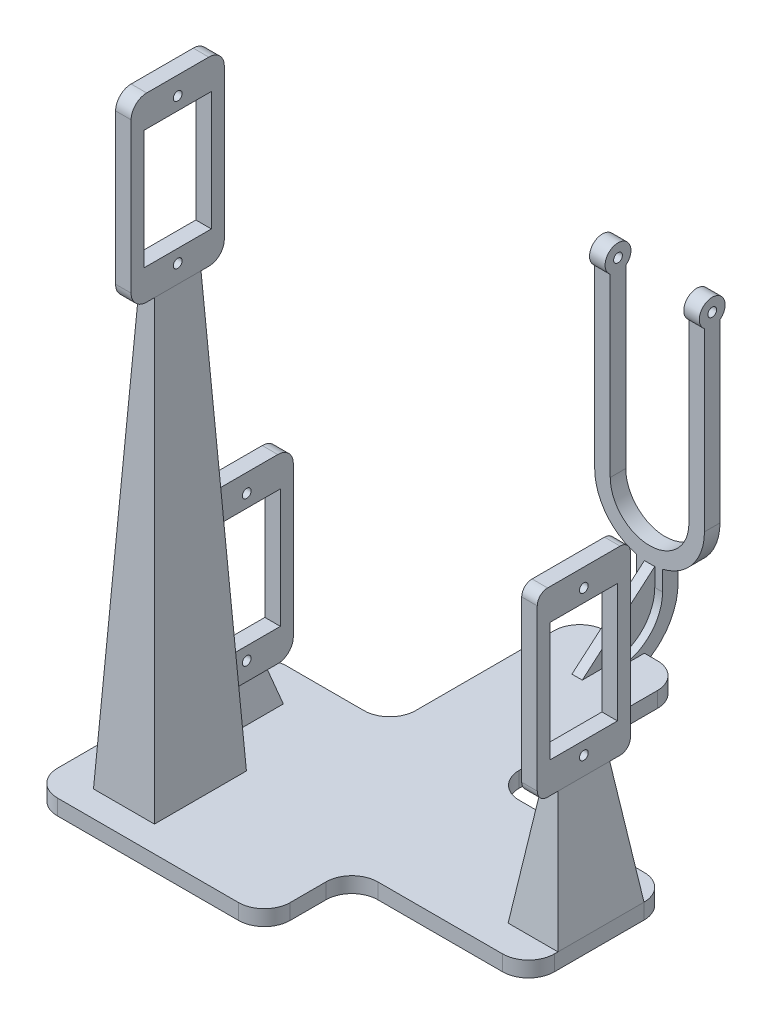
from build123d import *

# Parameters (mm, degrees)
ESBO_O1_R                     = 2.5
RESSALTO_EXTRUS_O1_DEPTH      = 10.6
ESBO_O8_W                     = 21.2
ESBO_O8_H                     = 35
RESSALTO_EXTRUS_O6_DEPTH      = 1.5
RESSALTO_EXTRUS_O2_DEPTH      = 1.5
CORTE_EXTRUS_O1_DEPTH         = 48.855720661
CORTE_EXTRUS_O1_DEPTH_BACK    = 48.855720661
ESBO_O3_W                     = 15.2
ESBO_O3_H                     = 37.5
CORTE_EXTRUS_O2_DEPTH         = 48.855720661
CORTE_EXTRUS_O2_DEPTH_BACK    = 48.855720661
ESBO_O4_R                     = 0.85
ESBO_O5_W                     = 3
ESBO_O5_H                     = 5
RESSALTO_EXTRUS_O3_DEPTH      = 2.5
RESSALTO_EXTRUS_O4_DEPTH      = 2.5
RESSALTO_EXTRUS_O5_START      = -58.6
ESBO_O7_W                     = 20
ESBO_O7_H                     = 64
RESSALTO_EXTRUS_O5_DEPTH      = 3
NERVURA2_REACH                = 95.102
ESBO_O10_WALL_W               = 206.642418638
ESBO_O10_WALL_H               = 2
ESBO_O11_W                    = 18
ESBO_O11_H                    = 35
RESSALTO_EXTRUS_O7_DEPTH      = 3
ESBO_O12_W                    = 13
ESBO_O12_H                    = 23
CORTE_EXTRUS_O3_DEPTH         = 106.818334895
ESBO_O13_R                    = 0.85
CORTE_EXTRUS_O4_DEPTH         = 106.818334895
FILETE1_R                     = 2
RESSALTO_EXTRUS_O11_OUTLINE_W = 9.625094948
RESSALTO_EXTRUS_O11_OUTLINE_H = 16.625094948
RESSALTO_EXTRUS_O11_DEPTH     = 23.57
RESSALTO_EXTRUS_O11_TAPER     = 8
RESSALTO_EXTRUS_O9_START      = -28.42
ESBO_O19_W                    = 18
ESBO_O19_H                    = 35
RESSALTO_EXTRUS_O9_DEPTH      = 3
ESBO_O20_W                    = 13
ESBO_O20_H                    = 23
CORTE_EXTRUS_O6_DEPTH         = 3
ESBO_O21_R                    = 0.85
CORTE_EXTRUS_O7_DEPTH         = 3
FILETE2_R                     = 3
RESSALTO_EXTRUS_O10_OUTLINE_W = 6.070697746
RESSALTO_EXTRUS_O10_OUTLINE_H = 11.070697746
RESSALTO_EXTRUS_O10_DEPTH     = 5.73
RESSALTO_EXTRUS_O10_TAPER     = 15
RESSALTO_EXTRUS_O13_START     = -23.62
ESBO_O28_W                    = 18
ESBO_O28_H                    = 35
RESSALTO_EXTRUS_O13_DEPTH     = 3
ESBO_O29_W                    = 13
ESBO_O29_H                    = 23
CORTE_EXTRUS_O8_DEPTH         = 3
ESBO_O30_R                    = 0.85
CORTE_EXTRUS_O9_DEPTH         = 3
FILETE4_R                     = 3
RESSALTO_EXTRUS_O14_OUTLINE_W = 11.77096594
RESSALTO_EXTRUS_O14_OUTLINE_H = 17.77096594
RESSALTO_EXTRUS_O14_DEPTH     = 83.68
RESSALTO_EXTRUS_O14_DRAFT     = -3
ESBO_O25_W                    = 34.112547474
ESBO_O25_H                    = 27.312547474
RESSALTO_EXTRUS_O12_DEPTH     = 3
ESBO_O32_W                    = 44.955348873
ESBO_O32_H                    = 44.228030444
RESSALTO_EXTRUS_O15_DEPTH     = 3
FILETE3_R                     = 5


# Read off the part's stored shape, not the designer's step: Ressalto-extrusão11, Ressalto-extrusão10, Ressalto-extrusão14
with BuildPart() as part:
    # Esboço1 → Ressalto-extrusão1 (new, symmetric)
    with BuildSketch(Plane(origin=(0, 0, 0), x_dir=(0, 0, -1), z_dir=(1, 0, 0))):
        Circle(ESBO_O1_R)
    extrude(amount=RESSALTO_EXTRUS_O1_DEPTH, both=True)

    # Esboço8 → Ressalto-extrusão6 (add, symmetric)
    with BuildSketch(Plane.XY):
        with Locations((0, -17.5)):
            Rectangle(ESBO_O8_W, ESBO_O8_H)
    extrude(amount=RESSALTO_EXTRUS_O6_DEPTH, both=True)

    # Esboço2 → Ressalto-extrusão2 (add, symmetric)
    with BuildSketch(Plane.XY):
        with BuildLine():
            Line((-10.6, -36), (-10.6, -35))
            Line((-10.6, -35), (-7.6, -35))
            Line((-7.6, -35), (-7.6, -36))
            ThreePointArc((-7.6, -36), (0, -43.6), (7.6, -36))
            Line((7.6, -36), (7.6, -35))
            Line((7.6, -35), (10.6, -35))
            Line((10.6, -35), (10.6, -36))
            ThreePointArc((10.6, -36), (0, -46.6), (-10.6, -36))
        make_face()
    extrude(amount=RESSALTO_EXTRUS_O2_DEPTH, both=True)

    # Esboço3 → Corte-extrusão1 (cut, two sides: drawn at the far end of the back side and taken through both)
    with BuildSketch(Plane.XY.offset(-CORTE_EXTRUS_O1_DEPTH_BACK)):
        with Locations((0, -16.25)):
            Rectangle(ESBO_O3_W, ESBO_O3_H)
    extrude(amount=CORTE_EXTRUS_O1_DEPTH + CORTE_EXTRUS_O1_DEPTH_BACK, mode=Mode.SUBTRACT)

    # Esboço4 → Corte-extrusão2 (cut, two sides: drawn at the far end of the back side and taken through both)
    with BuildSketch(Plane(origin=(0, 0, 0), x_dir=(0, 0, -1), z_dir=(1, 0, 0)).offset(-CORTE_EXTRUS_O2_DEPTH_BACK)):
        Circle(ESBO_O4_R)
    extrude(amount=CORTE_EXTRUS_O2_DEPTH + CORTE_EXTRUS_O2_DEPTH_BACK, mode=Mode.SUBTRACT)

    # Esboço5 → Ressalto-extrusão3 (add, symmetric)
    with BuildSketch(Plane(origin=(0, 0, 0), x_dir=(0, 0, -1), z_dir=(1, 0, 0))):
        with Locations((0, -47.6)):
            Rectangle(ESBO_O5_W, ESBO_O5_H)
    extrude(amount=RESSALTO_EXTRUS_O3_DEPTH, both=True)

    # Esboço6 → Ressalto-extrusão4 (add, symmetric)
    with BuildSketch(Plane(origin=(0, 0, 0), x_dir=(0, 0, -1), z_dir=(1, 0, 0))):
        with BuildLine():
            ThreePointArc((-10, -61.6), (-1.868272016, -58.231727984), (1.5, -50.1))
            ThreePointArc((1.5, -50.1), (0, -48.6), (-1.5, -50.1))
            ThreePointArc((-1.5, -50.1), (-3.98959236, -56.11040764), (-10, -58.6))
            ThreePointArc((-10, -58.6), (-11.5, -60.1), (-10, -61.6))
        make_face()
    extrude(amount=RESSALTO_EXTRUS_O4_DEPTH, both=True)

    # Esboço7 → Ressalto-extrusão5 (add)
    with BuildSketch(Plane(origin=(0, 0, 0), x_dir=(1, 0, 0), z_dir=(0, 1, 0)).offset(RESSALTO_EXTRUS_O5_START)):
        with Locations((0, -37)):
            Rectangle(ESBO_O7_W, ESBO_O7_H)
    extrude(amount=-RESSALTO_EXTRUS_O5_DEPTH)

    # Esboço10 wall → Nervura2 (add, up to next)
    with BuildSketch(Plane(origin=(0, -52.6, 8.5), x_dir=(0, -0.650791373456, 0.759256602365), z_dir=(0, -0.759256602365, -0.650791373456)), mode=Mode.PRIVATE) as nervura2_sk1:
        Rectangle(ESBO_O10_WALL_W, ESBO_O10_WALL_H)
    nervura2_tool1 = extrude(nervura2_sk1.sketch, amount=NERVURA2_REACH, mode=Mode.PRIVATE) - part.part
    add(nervura2_tool1.solids().sort_by_distance((0, -52.6, 8.5))[0])



with BuildPart() as body_2:
    # Esboço11 → Ressalto-extrusão7 (new body)
    with BuildSketch(Plane(origin=(37.8, 0, 0), x_dir=(0, 0, -1), z_dir=(1, 0, 0))):
        with Locations((-55, -17.53)):
            Rectangle(ESBO_O11_W, ESBO_O11_H)
    extrude(amount=RESSALTO_EXTRUS_O7_DEPTH)

    # Esboço12 → Corte-extrusão3 (cut, through all)
    with BuildSketch(Plane(origin=(40.8, 0, 0), x_dir=(0, 0, -1), z_dir=(1, 0, 0))):
        with Locations((-55, -17.53)):
            Rectangle(ESBO_O12_W, ESBO_O12_H)
    extrude(amount=-CORTE_EXTRUS_O3_DEPTH, mode=Mode.SUBTRACT)

    # Esboço13 → Corte-extrusão4 (cut, through all)
    with BuildSketch(Plane(origin=(40.8, 0, 0), x_dir=(0, 0, -1), z_dir=(1, 0, 0))):
        with Locations((-55, -3.53)):
            Circle(ESBO_O13_R)
        with Locations((-55, -31.53)):
            Circle(ESBO_O13_R)
    extrude(amount=-CORTE_EXTRUS_O4_DEPTH, mode=Mode.SUBTRACT)

    # Filete1
    filete1_edges = [body_2.edges().sort_by_distance(p)[0] for p in [
        (39.3, -0.03, 64),
        (39.3, -0.03, 46),
        (39.3, -35.03, 46),
        (39.3, -35.03, 64),
    ]]
    fillet(filete1_edges, radius=FILETE1_R)

    # Ressalto-extrusão11 outline → Ressalto-extrusão11 (add)
    with BuildSketch(Plane(origin=(0, -58.6, 0), x_dir=(1, 0, 0), z_dir=(0, 1, 0))):
        with Locations((39.3, -55)):
            Rectangle(RESSALTO_EXTRUS_O11_OUTLINE_W, RESSALTO_EXTRUS_O11_OUTLINE_H)
    extrude(amount=RESSALTO_EXTRUS_O11_DEPTH, taper=RESSALTO_EXTRUS_O11_TAPER)


with BuildPart() as body_3:
    # Esboço19 → Ressalto-extrusão9 (new body)
    with BuildSketch(Plane(origin=(0, 0, 0), x_dir=(0, 0, -1), z_dir=(1, 0, 0)).offset(RESSALTO_EXTRUS_O9_START)):
        with Locations((-53.9, -35.37)):
            Rectangle(ESBO_O19_W, ESBO_O19_H)
    extrude(amount=RESSALTO_EXTRUS_O9_DEPTH)

    # Esboço20 → Corte-extrusão6 (cut)
    with BuildSketch(Plane.ZY.offset(28.42)):
        with Locations((53.9, -35.37)):
            Rectangle(ESBO_O20_W, ESBO_O20_H)
    extrude(amount=-CORTE_EXTRUS_O6_DEPTH, mode=Mode.SUBTRACT)

    # Esboço21 → Corte-extrusão7 (cut)
    with BuildSketch(Plane.ZY.offset(28.42)):
        with Locations((53.9, -21.37)):
            Circle(ESBO_O21_R)
        with Locations((53.9, -49.37)):
            Circle(ESBO_O21_R)
    extrude(amount=-CORTE_EXTRUS_O7_DEPTH, mode=Mode.SUBTRACT)

    # Filete2
    filete2_edges = [body_3.edges().sort_by_distance(p)[0] for p in [
        (-26.92, -17.87, 62.9),
        (-26.92, -17.87, 44.9),
        (-26.92, -52.87, 44.9),
        (-26.92, -52.87, 62.9),
    ]]
    fillet(filete2_edges, radius=FILETE2_R)

    # Ressalto-extrusão10 outline → Ressalto-extrusão10 (add)
    with BuildSketch(Plane(origin=(0, -58.6, 0), x_dir=(1, 0, 0), z_dir=(0, 1, 0))):
        with Locations((-26.92, -53.9)):
            Rectangle(RESSALTO_EXTRUS_O10_OUTLINE_W, RESSALTO_EXTRUS_O10_OUTLINE_H)
    extrude(amount=RESSALTO_EXTRUS_O10_DEPTH, taper=RESSALTO_EXTRUS_O10_TAPER)


with BuildPart() as body_4:
    # Esboço28 → Ressalto-extrusão13 (new body)
    with BuildSketch(Plane(origin=(0, 0, 0), x_dir=(0, 0, -1), z_dir=(1, 0, 0)).offset(RESSALTO_EXTRUS_O13_START)):
        with Locations((-72.03, 42.58)):
            Rectangle(ESBO_O28_W, ESBO_O28_H)
    extrude(amount=RESSALTO_EXTRUS_O13_DEPTH)

    # Esboço29 → Corte-extrusão8 (cut)
    with BuildSketch(Plane(origin=(-20.62, 0, 0), x_dir=(0, 0, -1), z_dir=(1, 0, 0))):
        with Locations((-72.03, 42.58)):
            Rectangle(ESBO_O29_W, ESBO_O29_H)
    extrude(amount=-CORTE_EXTRUS_O8_DEPTH, mode=Mode.SUBTRACT)

    # Esboço30 → Corte-extrusão9 (cut)
    with BuildSketch(Plane(origin=(-20.62, 0, 0), x_dir=(0, 0, -1), z_dir=(1, 0, 0))):
        with Locations((-72.03, 56.58)):
            Circle(ESBO_O30_R)
        with Locations((-72.03, 28.58)):
            Circle(ESBO_O30_R)
    extrude(amount=-CORTE_EXTRUS_O9_DEPTH, mode=Mode.SUBTRACT)

    # Filete4
    filete4_edges = [body_4.edges().sort_by_distance(p)[0] for p in [
        (-22.12, 60.08, 81.03),
        (-22.12, 60.08, 63.03),
        (-22.12, 25.08, 63.03),
        (-22.12, 25.08, 81.03),
    ]]
    fillet(filete4_edges, radius=FILETE4_R)


with BuildPart() as ressalto_extrus_o14_tool:
    # Ressalto-extrusão14 outline → Ressalto-extrusão14 (with draft: the straight prism first)
    with BuildSketch(Plane.XZ.offset(58.6)):
        with Locations((-22.12, 72.03)):
            Rectangle(RESSALTO_EXTRUS_O14_OUTLINE_W, RESSALTO_EXTRUS_O14_OUTLINE_H)
    extrude(amount=-RESSALTO_EXTRUS_O14_DEPTH)
    # Ressalto-extrusão14: the draft: its side faces are tilted about the plane it starts from
    ressalto_extrus_o14_sides = [ressalto_extrus_o14_tool.faces().sort_by_distance(p)[0] for p in [
        (-22.12, -16.76, 80.91548297),
        (-28.00548297, -16.76, 72.03),
        (-22.12, -16.76, 63.14451703),
        (-16.23451703, -16.76, 72.03),
    ]]
    draft(ressalto_extrus_o14_sides, Plane.XZ.offset(58.6), RESSALTO_EXTRUS_O14_DRAFT)


with BuildPart() as body_4_1:
    add(body_4.part)

    # Ressalto-extrusão14: add ressalto_extrus_o14_tool
    add(ressalto_extrus_o14_tool.part)


with BuildPart() as part_1:
    add(part.part)

    add(body_2.part)  # Ressalto-extrusão12 merges body 2
    # Esboço25 → Ressalto-extrusão12 (add)
    with BuildSketch(Plane(origin=(0, -58.6, 0), x_dir=(1, 0, 0), z_dir=(0, 1, 0))):
        with Locations((27.056273737, -55.343726263)):
            Rectangle(ESBO_O25_W, ESBO_O25_H)
    extrude(amount=-RESSALTO_EXTRUS_O12_DEPTH)


    add(body_3.part)  # Ressalto-extrusão15 merges body 3

    add(body_4_1.part)  # Ressalto-extrusão15 merges body 4
    # Esboço32 → Ressalto-extrusão15 (add)
    with BuildSketch(Plane(origin=(0, -58.6, 0), x_dir=(1, 0, 0), z_dir=(0, 1, 0))):
        with Locations((-12.477674437, -63.801467748)):
            Rectangle(ESBO_O32_W, ESBO_O32_H)
    extrude(amount=-RESSALTO_EXTRUS_O15_DEPTH)

    # Filete3
    filete3_edges = [part_1.edges().sort_by_distance(p)[0] for p in [
        (-34.955348873, -60.1, 85.91548297),
        (-34.955348873, -60.1, 41.687452526),
        (10, -60.1, 85.91548297),
        (-10, -60.1, 41.687452526),
        (-10, -60.1, 5),
        (10, -60.1, 5),
        (10, -60.1, 69),
        (44.112547474, -60.1, 69),
        (10, -60.1, 41.687452526),
        (44.112547474, -60.1, 41.687452526),
    ]]
    fillet(filete3_edges, radius=FILETE3_R)


solid = part_1.part
